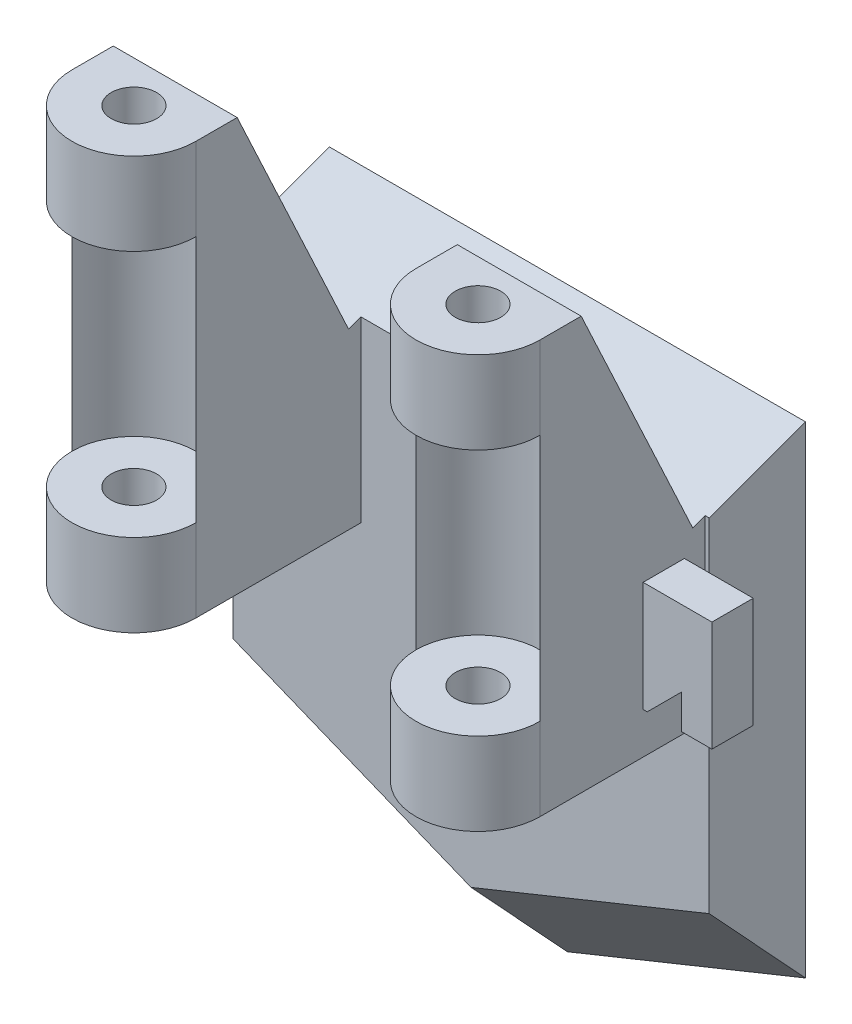
from build123d import *

# Parameters (mm, degrees)
ESBO_O1_W                  = 34.6
ESBO_O1_H                  = 26
RESSALTO_EXTRUS_O1_DEPTH   = 7
ESBO_O10_W                 = 34.6
ESBO_O10_H                 = 2.5
RESSALTO_EXTRUS_O4_DEPTH   = 7
CHANFRO1_SIZE              = 7
CHANFRO2_SIZE2             = 7
CHANFRO2_SIZE              = 2.54779164
ESBO_O12_R                 = 1.65
RESSALTO_EXTRUS_O5_DEPTH   = 30
RESSALTO_EXTRUS_O6_START   = 3
RESSALTO_EXTRUS_O6_DEPTH   = 8
CORTE_EXTRUS_O2_DEPTH      = 40.089640571
CORTE_EXTRUS_O2_DEPTH_BACK = 40.089640571
CHANFRO3_SIZE              = 9
CHANFRO3_SIZE_2            = 19.300562285
CORTE_EXTRUS_O3_START      = -24
ESBO_O17_R                 = 4.5
CORTE_EXTRUS_O3_DEPTH      = 18


# Some blends are built 0.0001 mm under size
with BuildPart() as part:
    # Esboço1 → Ressalto-extrusão1 (new body)
    with BuildSketch(Plane.XY):
        Rectangle(ESBO_O1_W, ESBO_O1_H)
    extrude(amount=RESSALTO_EXTRUS_O1_DEPTH)

    # Esboço10 → Ressalto-extrusão4 (add)
    with BuildSketch(Plane(origin=(0, 0, 0), x_dir=(-1, 0, 0), z_dir=(0, 0, -1))):
        Polygon((-17.3, -19.5), (0, -26.5), (17.3, -19.5), (17.3, -13), (-17.3, -13), align=None)
        with Locations((0, 14.25)):
            Rectangle(ESBO_O10_W, ESBO_O10_H)
    extrude(amount=-RESSALTO_EXTRUS_O4_DEPTH)

    # Chanfro1
    chanfro1_edges = [part.edges().sort_by_distance(p)[0] for p in [
        (8.65, -23, 7),
        (-8.65, -23, 7),
    ]]
    chamfer(chanfro1_edges, length=CHANFRO1_SIZE - 0.0001)  # a hair under: the kernel refuses the full size

    # Chanfro2
    chanfro2_edges = [part.edges().sort_by_distance(p)[0] for p in [
        (0, 15.5, 7),
    ]]
    chanfro2_side = [part.faces().sort_by_distance(p)[0] for p in [
        (0, 15.449044167, 7),
    ]]
    chamfer(chanfro2_edges, length=CHANFRO2_SIZE - 0.0001, length2=CHANFRO2_SIZE2 - 0.0001, reference=chanfro2_side[0])  # a hair under: the kernel refuses the full size

    # Esboço12 → Ressalto-extrusão5 (add)
    # profile 1 of 2: a face of its own
    with BuildSketch(Plane(origin=(0, 0, 0), x_dir=(1, 0, 0), z_dir=(0, 1, 0))):
        with BuildLine():
            Line((-17, -19), (-17, -7))
            Line((-17, -7), (-8, -7))
            Line((-8, -7), (-8, -19))
            ThreePointArc((-8, -19), (-12.5, -23.5), (-17, -19))
        make_face()
        with Locations(Location((-12.5, -19, 0), (0, 0, 270))):
            Circle(ESBO_O12_R, mode=Mode.SUBTRACT)
    # profile 2 of 2: a face of its own
    with BuildSketch(Plane(origin=(0, 0, 0), x_dir=(1, 0, 0), z_dir=(0, 1, 0))):
        with BuildLine():
            Line((8, -7), (8, -19))
            ThreePointArc((8, -19), (12.5, -23.5), (17, -19))
            Line((17, -19), (17, -7))
            Line((17, -7), (8, -7))
        make_face()
        with Locations(Location((12.5, -19, 0), (0, 0, 90))):
            Circle(ESBO_O12_R, mode=Mode.SUBTRACT)
    extrude(amount=RESSALTO_EXTRUS_O5_DEPTH)

    # Esboço15 → Ressalto-extrusão6 (add)
    with BuildSketch(Plane(origin=(0, 0, 0), x_dir=(1, 0, 0), z_dir=(0, 1, 0)).offset(RESSALTO_EXTRUS_O6_START)):
        Polygon((-22, -11.5), (-22, -8.5), (-17, -8.5), (-17, -7), (-8, -7), (-8, -11.5), align=None)
        Polygon((17, -8.5), (17, -7), (8, -7), (8, -11.5), (22, -11.5), (22, -8.5), align=None)
    extrude(amount=RESSALTO_EXTRUS_O6_DEPTH)

    # Esboço16 → Corte-extrusão2 (cut, two sides: drawn at the far end of the back side and taken through both)
    with BuildSketch(Plane.XY.offset(11.5).offset(-CORTE_EXTRUS_O2_DEPTH_BACK)):
        Polygon((-17.3, 3), (-19.8, 5.5), (-19.8, 3), align=None)
        Polygon((19.8, 3), (17.3, 3), (19.8, 5.5), align=None)
    extrude(amount=CORTE_EXTRUS_O2_DEPTH + CORTE_EXTRUS_O2_DEPTH_BACK, mode=Mode.SUBTRACT)

    # Chanfro3
    # the kernel refuses this chamfer: 19.300562285, 9 mm, written as the material it takes off along each edge
    with BuildSketch(Plane(origin=(-67.007283464, 30, 7), x_dir=(0, 0.07481330637060048, 0.9971975577536772), z_dir=(1, 0, 0))) as chanfro3_piece_1_section:
        Polygon((CHANFRO3_SIZE * 0.997197557754, CHANFRO3_SIZE * 0.0748133063706), (-CHANFRO3_SIZE_2 * 0.074813306369, CHANFRO3_SIZE_2 * 0.997197557732), (0, 0), align=None)
    chanfro3_piece_1 = extrude(amount=109.014566928, mode=Mode.PRIVATE)
    chanfro3_piece_1 = split(chanfro3_piece_1, bisect_by=Plane(origin=(-12.5, 13.283132455, 6.091045576), z_dir=(0, 0.9396953649145792, 0.34201260380000037)), keep=Keep.TOP, mode=Mode.PRIVATE)
    add(chanfro3_piece_1, mode=Mode.SUBTRACT)
    with BuildSketch(Plane(origin=(67.007283464, 30, 7), x_dir=(0, -0.9998669641130703, -0.01631116413111024), z_dir=(-1, 0, 0))) as chanfro3_piece_2_section:
        Polygon((CHANFRO3_SIZE_2 * 0.999866964092, CHANFRO3_SIZE_2 * 0.0163111641308), (-CHANFRO3_SIZE * 0.0163111641311, CHANFRO3_SIZE * 0.999866964113), (0, 0), align=None)
    chanfro3_piece_2 = extrude(amount=109.014566928, mode=Mode.PRIVATE)
    chanfro3_piece_2 = split(chanfro3_piece_2, bisect_by=Plane(origin=(12.5, 13.283132455, 6.091045576), z_dir=(0, 0.9396953649145792, 0.34201260380000037)), keep=Keep.TOP, mode=Mode.PRIVATE)
    add(chanfro3_piece_2, mode=Mode.SUBTRACT)

    # Esboço17 → Corte-extrusão3 (cut)
    with BuildSketch(Plane.XZ.offset(CORTE_EXTRUS_O3_START)):
        with Locations((-12.5, 19)):
            Circle(ESBO_O17_R)
        with Locations((12.5, 19)):
            Circle(ESBO_O17_R)
    extrude(amount=CORTE_EXTRUS_O3_DEPTH, mode=Mode.SUBTRACT)


solid = part.part
